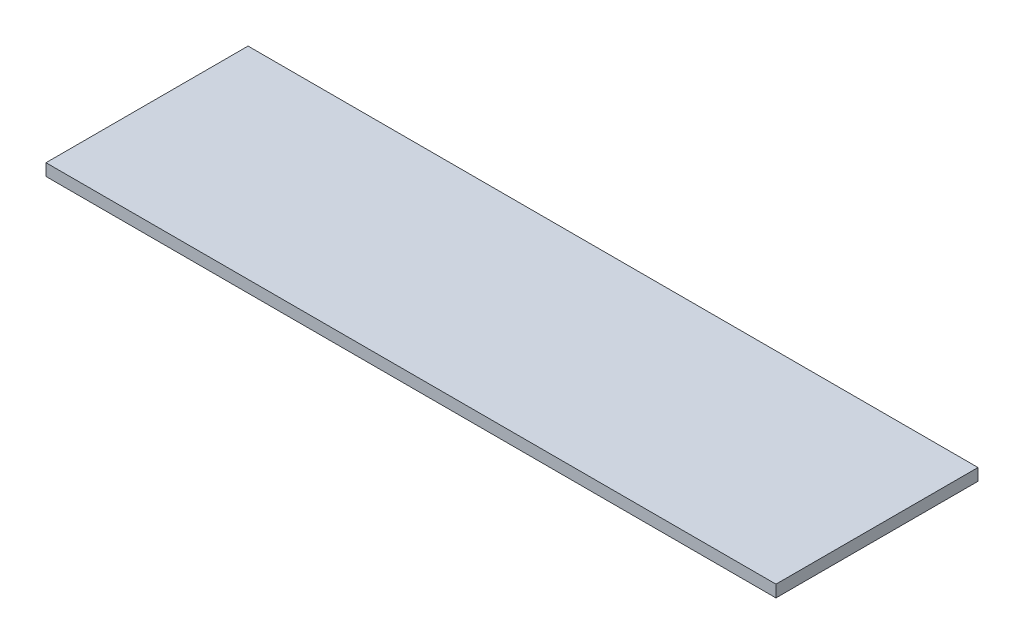
from build123d import *

# Parameters (mm, degrees)
SKETCH1_W           = 1066.8
SKETCH1_H           = 295.275
BOSS_EXTRUDE1_DEPTH = 17.4752


with BuildPart() as part:
    # Sketch1 → Boss-Extrude1 (new body)
    with BuildSketch(Plane(origin=(0, 0, 0), x_dir=(1, 0, 0), z_dir=(0, 1, 0))):
        Rectangle(SKETCH1_W, SKETCH1_H)
    extrude(amount=BOSS_EXTRUDE1_DEPTH)


solid = part.part
